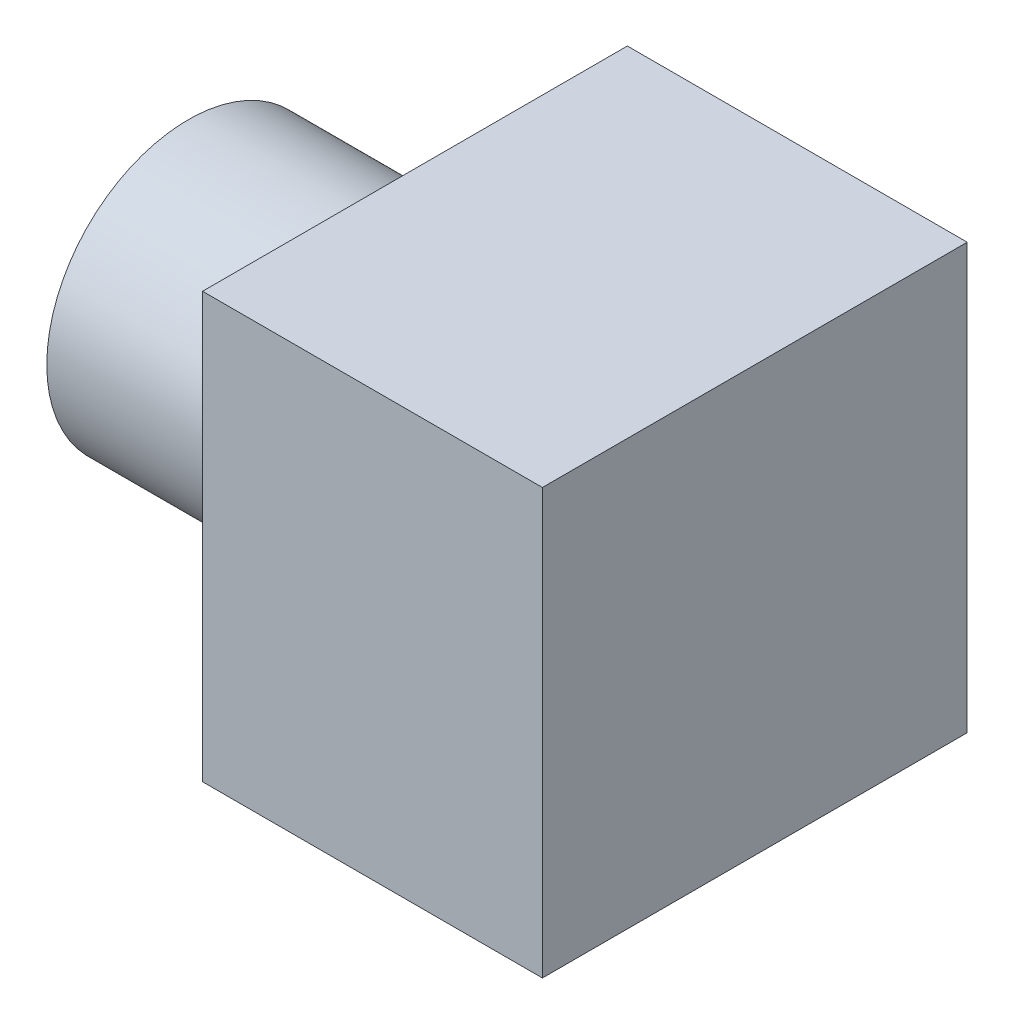
from build123d import *

# Parameters (mm, degrees)
SKETCH2_R           = 5
BOSS_EXTRUDE1_DEPTH = 8
SKETCH3_W           = 15
SKETCH3_H           = 15
BOSS_EXTRUDE2_DEPTH = 12


with BuildPart() as part:
    # Sketch2 → Boss-Extrude1 (new body)
    with BuildSketch(Plane.ZY.offset(36.137829577)):
        with Locations((-25, -31.600577771)):
            Circle(SKETCH2_R)
    extrude(amount=BOSS_EXTRUDE1_DEPTH)

    # Sketch3 → Boss-Extrude2 (add)
    with BuildSketch(Plane(origin=(-36.137829577, 0, 0), x_dir=(0, 0, -1), z_dir=(1, 0, 0))):
        with Locations((25, -31.600577771)):
            Rectangle(SKETCH3_W, SKETCH3_H)
    extrude(amount=BOSS_EXTRUDE2_DEPTH)


solid = part.part
